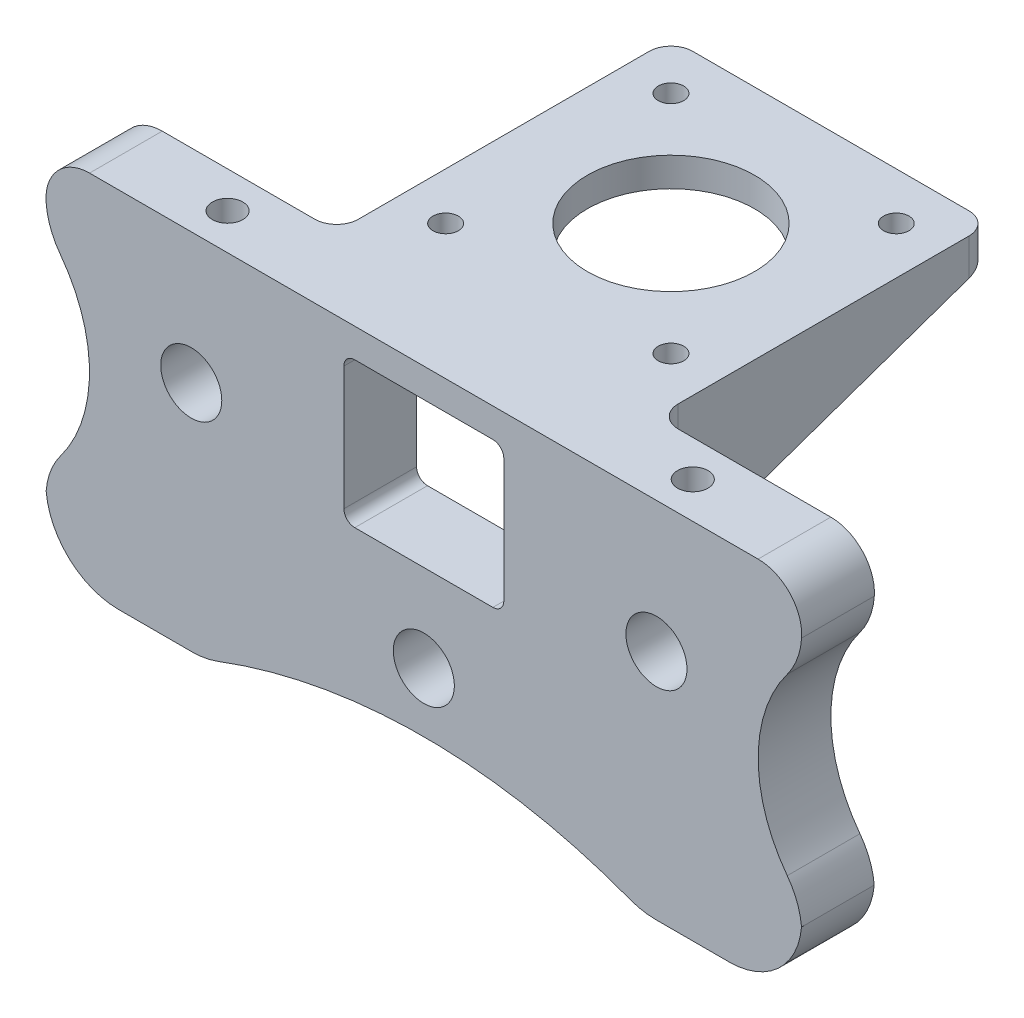
from build123d import *

# Parameters (mm, degrees)
SKETCH1_R           = 4.2
BOSS_EXTRUDE1_DEPTH = 5
FILLET1_R           = 10
FILLET2_R           = 6
SKETCH2_W           = 42
SKETCH2_H           = 46
SKETCH2_R           = 11.5
SKETCH2_R_2         = 1.75
BOSS_EXTRUDE2_DEPTH = 4
CUT_EXTRUDE1_REACH  = 89.139
CUT_EXTRUDE1_START  = -1
SKETCH3_R           = 3
CUT_EXTRUDE2_REACH  = 90.34
SKETCH4_R           = 1.75
SKETCH5_R           = 2.1
CUT_EXTRUDE3_DEPTH  = 4
CHAMFER1_SIZE       = 0.5
BOSS_EXTRUDE3_START = -2
BOSS_EXTRUDE3_DEPTH = 3
FILLET3_R           = 2
FILLET4_R           = 3


with BuildPart() as part:
    # Sketch1 → Boss-Extrude1 (new, symmetric)
    with BuildSketch(Plane.XY):
        with BuildLine():
            Line((-52, 25), (52, 25))
            Line((52, 25), (52, 15.565713714))
            ThreePointArc((52, 15.565713714), (46, 1.282856857), (52, -13))
            Line((52, -13), (52, -25))
            Line((52, -25), (30, -25))
            ThreePointArc((30, -25), (0, -19.161984871), (-30, -25))
            Line((-30, -25), (-52, -25))
            Line((-52, -25), (-52, -13))
            ThreePointArc((-52, -13), (-46, 1.282856857), (-52, 15.565713714))
            Line((-52, 15.565713714), (-52, 25))
        make_face()
        with Locations((0, -11)):
            Circle(SKETCH1_R, mode=Mode.SUBTRACT)
        with Locations((-32, 7)):
            Circle(SKETCH1_R, mode=Mode.SUBTRACT)
        with Locations((32, 7)):
            Circle(SKETCH1_R, mode=Mode.SUBTRACT)
        with BuildLine():
            Line((-9.5, 21), (9.5, 21))
            ThreePointArc((9.5, 21), (10.560660172, 20.560660172), (11, 19.5))
            Line((11, 19.5), (11, 2.5))
            ThreePointArc((11, 2.5), (10.560660172, 1.439339828), (9.5, 1))
            Line((9.5, 1), (-9.5, 1))
            ThreePointArc((-9.5, 1), (-10.560660172, 1.439339828), (-11, 2.5))
            Line((-11, 2.5), (-11, 19.5))
            ThreePointArc((-11, 19.5), (-10.560660172, 20.560660172), (-9.5, 21))
        make_face(mode=Mode.SUBTRACT)
    extrude(amount=BOSS_EXTRUDE1_DEPTH, both=True)

    # Fillet1
    # the kernel refuses this fillet: 10 mm, written as the material it takes off along each edge
    with BuildSketch(Plane(origin=(52, 15.565713714, 14.292857857), x_dir=(-0.6589710561597435, -0.7521682970876347, 0), z_dir=(0, 0, -1))) as fillet1_piece_1:
        with BuildLine():
            CenterArc((3.793793334, 9.971172714), FILLET1_R, 228.778553177, 36.869897646)
            Line((-2.795917228, 2.449489743), (0, 0))
            ThreePointArc((0, 0), (1.517517334, 0.057654573), (3.035034667, 0))
        make_face()
    extrude(amount=28.585715715, mode=Mode.SUBTRACT)
    with BuildSketch(Plane(origin=(52, -13, 14.292857857), x_dir=(0, -1, 0), z_dir=(0, 0, -1)), Plane(origin=(-52, -13, -14.292857857), x_dir=(0, -1, 0), z_dir=(0, 0, 1))) as fillet1_piece_2:
        with BuildLine():
            CenterArc((3.717143143, 10), FILLET1_R, 233.130102354, 36.869897646)
            ThreePointArc((-2.282856857, 2), (-1.103435734, 1.043365942), (0, 0))
            Line((0, 0), (3.717143143, 0))
        make_face()
    extrude(amount=28.585715715, mode=Mode.SUBTRACT)
    with BuildSketch(Plane(origin=(52, -25, 30), x_dir=(-1, 0, 0), z_dir=(0, 0, -1))) as fillet1_piece_3:
        with BuildLine():
            CenterArc((FILLET1_R, FILLET1_R), FILLET1_R, 180, 90)
            Line((0, FILLET1_R), (0, 0))
            Line((0, 0), (FILLET1_R, 0))
        make_face()
    extrude(amount=60, mode=Mode.SUBTRACT)
    with BuildSketch(Plane(origin=(30, -25, 9.716697693), x_dir=(-0.931136532102541, 0.3646707536724787, 0), z_dir=(0, 0, -1))) as fillet1_piece_4:
        with BuildLine():
            CenterArc((1.889951723, 9.999382002), FILLET1_R, 248.612678269, 20.750330625)
            Line((-1.756755813, 0.688016681), (0, 0))
            ThreePointArc((0, 0), (0.889389046, 0.004943983), (1.778778093, 0))
        make_face()
    extrude(amount=19.433395387, mode=Mode.SUBTRACT)
    with BuildSketch(Plane(origin=(-30, -25, 9.716697693), x_dir=(-1, 0, 0), z_dir=(0, 0, -1))) as fillet1_piece_5:
        with BuildLine():
            CenterArc((1.886679077, 10), FILLET1_R, 249.249669375, 20.750330625)
            ThreePointArc((-1.656285265, 0.648668348), (-0.826339706, 0.328937697), (0, 0))
            Line((0, 0), (1.886679077, 0))
        make_face()
    extrude(amount=19.433395387, mode=Mode.SUBTRACT)
    with BuildSketch(Plane(origin=(-52, -25, -30), x_dir=(0, 1, 0), z_dir=(0, 0, 1))) as fillet1_piece_6:
        with BuildLine():
            CenterArc((FILLET1_R, -FILLET1_R), FILLET1_R, 90, 90)
            Line((0, -FILLET1_R), (0, 0))
            Line((0, 0), (FILLET1_R, 0))
        make_face()
    extrude(amount=60, mode=Mode.SUBTRACT)
    with BuildSketch(Plane(origin=(-52, 15.565713714, -14.292857857), x_dir=(0, 1, 0), z_dir=(0, 0, 1))) as fillet1_piece_7:
        with BuildLine():
            CenterArc((3.717143143, -10), FILLET1_R, 90, 36.869897646)
            ThreePointArc((-2.282856857, -2), (-1.103435734, -1.043365942), (0, 0))
            Line((0, 0), (3.717143143, 0))
        make_face()
    extrude(amount=28.585715715, mode=Mode.SUBTRACT)

    # Fillet2
    fillet2_edges = [part.edges().sort_by_distance(p)[0] for p in [
        (52, 25, 0),
        (-52, 25, 0),
    ]]
    fillet(fillet2_edges, radius=FILLET2_R)

    # Sketch2 → Boss-Extrude2 (add)
    with BuildSketch(Plane(origin=(0, 25, -30), x_dir=(-1, 0, 0), z_dir=(0, 1, 0))):
        with Locations((0, 2)):
            Rectangle(SKETCH2_W, SKETCH2_H)
        with Locations(Location((0, 1, 0), (0, 0, 90))):
            Circle(SKETCH2_R, mode=Mode.SUBTRACT)
        with Locations(Location((15.5, 16.5, 0), (0, 0, 90))):
            Circle(SKETCH2_R_2, mode=Mode.SUBTRACT)
        with Locations(Location((-15.5, 16.5, 0), (0, 0, 90))):
            Circle(SKETCH2_R_2, mode=Mode.SUBTRACT)
        with Locations(Location((-15.5, -14.5, 0), (0, 0, 90))):
            Circle(SKETCH2_R_2, mode=Mode.SUBTRACT)
        with Locations(Location((15.5, -14.5, 0), (0, 0, 90))):
            Circle(SKETCH2_R_2, mode=Mode.SUBTRACT)
    extrude(amount=-BOSS_EXTRUDE2_DEPTH)

    # Sketch3 → Cut-Extrude1 (cut, up to next)
    with BuildSketch(Plane.XZ.offset(-21).offset(CUT_EXTRUDE1_START), mode=Mode.PRIVATE) as cut_extrude1_sk1:
        with Locations(Location((-15.5, -44.5, 0), (0, 0, 270))):
            Circle(SKETCH3_R)
    cut_extrude1_tool1 = extrude(cut_extrude1_sk1.sketch, amount=CUT_EXTRUDE1_REACH, mode=Mode.PRIVATE) & part.part
    # Sketch3 → Cut-Extrude1 (cut, up to next)
    with BuildSketch(Plane.XZ.offset(-21).offset(CUT_EXTRUDE1_START), mode=Mode.PRIVATE) as cut_extrude1_sk2:
        with Locations(Location((15.5, -44.5, 0), (0, 0, 270))):
            Circle(SKETCH3_R)
    cut_extrude1_tool2 = extrude(cut_extrude1_sk2.sketch, amount=CUT_EXTRUDE1_REACH, mode=Mode.PRIVATE) & part.part
    # Sketch3 → Cut-Extrude1 (cut, up to next)
    with BuildSketch(Plane.XZ.offset(-21).offset(CUT_EXTRUDE1_START), mode=Mode.PRIVATE) as cut_extrude1_sk3:
        with Locations(Location((15.5, -13.5, 0), (0, 0, 270))):
            Circle(SKETCH3_R)
    cut_extrude1_tool3 = extrude(cut_extrude1_sk3.sketch, amount=CUT_EXTRUDE1_REACH, mode=Mode.PRIVATE) & part.part
    # Sketch3 → Cut-Extrude1 (cut, up to next)
    with BuildSketch(Plane.XZ.offset(-21).offset(CUT_EXTRUDE1_START), mode=Mode.PRIVATE) as cut_extrude1_sk4:
        with Locations(Location((-15.5, -13.5, 0), (0, 0, 270))):
            Circle(SKETCH3_R)
    cut_extrude1_tool4 = extrude(cut_extrude1_sk4.sketch, amount=CUT_EXTRUDE1_REACH, mode=Mode.PRIVATE) & part.part
    add(cut_extrude1_tool1.solids().sort_by_distance((-15.5, 22, -44.5))[0], mode=Mode.SUBTRACT)
    add(cut_extrude1_tool2.solids().sort_by_distance((15.5, 22, -44.5))[0], mode=Mode.SUBTRACT)
    add(cut_extrude1_tool3.solids().sort_by_distance((15.5, 22, -13.5))[0], mode=Mode.SUBTRACT)
    add(cut_extrude1_tool4.solids().sort_by_distance((-15.5, 22, -13.5))[0], mode=Mode.SUBTRACT)

    # Sketch4 → Cut-Extrude2 (cut, up to next)
    with BuildSketch(Plane(origin=(0, 25, 0), x_dir=(1, 0, 0), z_dir=(0, 1, 0)), mode=Mode.PRIVATE) as cut_extrude2_sk1:
        with Locations(Location((-32, 0, 0), (0, 0, 270))):
            Circle(SKETCH4_R)
    cut_extrude2_tool1 = extrude(cut_extrude2_sk1.sketch, amount=-CUT_EXTRUDE2_REACH, mode=Mode.PRIVATE) & part.part
    # Sketch4 → Cut-Extrude2 (cut, up to next)
    with BuildSketch(Plane(origin=(0, 25, 0), x_dir=(1, 0, 0), z_dir=(0, 1, 0)), mode=Mode.PRIVATE) as cut_extrude2_sk2:
        with Locations(Location((32, 0, 0), (0, 0, 270))):
            Circle(SKETCH4_R)
    cut_extrude2_tool2 = extrude(cut_extrude2_sk2.sketch, amount=-CUT_EXTRUDE2_REACH, mode=Mode.PRIVATE) & part.part
    add(cut_extrude2_tool1.solids().sort_by_distance((-32, 25, 0))[0], mode=Mode.SUBTRACT)
    add(cut_extrude2_tool2.solids().sort_by_distance((32, 25, 0))[0], mode=Mode.SUBTRACT)

    # Sketch5 → Cut-Extrude3 (cut)
    with BuildSketch(Plane(origin=(0, 25, 0), x_dir=(1, 0, 0), z_dir=(0, 1, 0))):
        with Locations(Location((-32, 0, 0), (0, 0, 270))):
            Circle(SKETCH5_R)
        with Locations(Location((32, 0, 0), (0, 0, 270))):
            Circle(SKETCH5_R)
    extrude(amount=-CUT_EXTRUDE3_DEPTH, mode=Mode.SUBTRACT)

    # Chamfer1
    # the kernel refuses this chamfer: 0.5 mm, written as the material it adds along each edge
    # the kernel refuses this chamfer: 0.5 mm, written as the material it takes off along each edge
    with BuildSketch(Plane(origin=(-32, 21, 0), x_dir=(0, 0, 1), z_dir=(-1, 0, 0))) as chamfer1_2_piece_1_section:
        Polygon((1.75, -CHAMFER1_SIZE), (1.75 + CHAMFER1_SIZE, 0), (1.75, 0), align=None)
    chamfer1_2_piece_1 = revolve(axis=Axis((-32, 21, 0), (0, 1, 0)), mode=Mode.PRIVATE)
    chamfer1_2_piece_1 = chamfer1_2_piece_1 & Plane(origin=(-32, 20.682821512, 0), x_dir=(0, 0, 1), z_dir=(0, 1, 0)) * Cylinder(2.1, 9, mode=Mode.PRIVATE)
    add(chamfer1_2_piece_1, mode=Mode.SUBTRACT)
    with BuildSketch(Plane(origin=(32, 21, 0), x_dir=(0, 0, 1), z_dir=(-1, 0, 0))) as chamfer1_2_piece_2_section:
        Polygon((1.75, -CHAMFER1_SIZE), (1.75 + CHAMFER1_SIZE, 0), (1.75, 0), align=None)
    chamfer1_2_piece_2 = revolve(axis=Axis((32, 21, 0), (0, 1, 0)), mode=Mode.PRIVATE)
    chamfer1_2_piece_2 = chamfer1_2_piece_2 & Plane(origin=(32, 20.682821512, 0), x_dir=(0, 0, 1), z_dir=(0, 1, 0)) * Cylinder(2.1, 10, mode=Mode.PRIVATE)
    add(chamfer1_2_piece_2, mode=Mode.SUBTRACT)

    # Sketch6 → Boss-Extrude3 (add)
    with BuildSketch(Plane.ZY.offset(21).offset(BOSS_EXTRUDE3_START)):
        Polygon((-51, 25), (-5, 25), (-5, 5), (-51, 21), align=None)
    boss_extrude3 = extrude(amount=BOSS_EXTRUDE3_DEPTH)

    # Mirror1: Boss-Extrude3 across plane
    add(boss_extrude3.mirror(Plane(origin=(0, 0, 0), x_dir=(0, 0, 1), z_dir=(1, 0, 0))))

    # Fillet3
    fillet3_edges = [part.edges().sort_by_distance(p)[0] for p in [
        (-14.25, 21, -5),
        (14.25, 21, -5),
    ]]
    fillet(fillet3_edges, radius=FILLET3_R)

    # Fillet4
    fillet4_edges = [part.edges().sort_by_distance(p)[0] for p in [
        (-22, 23, -51),
        (22, 23, -51),
        (-22, 15, -5),
        (22, 15, -5),
    ]]
    fillet(fillet4_edges, radius=FILLET4_R)


solid = part.part
